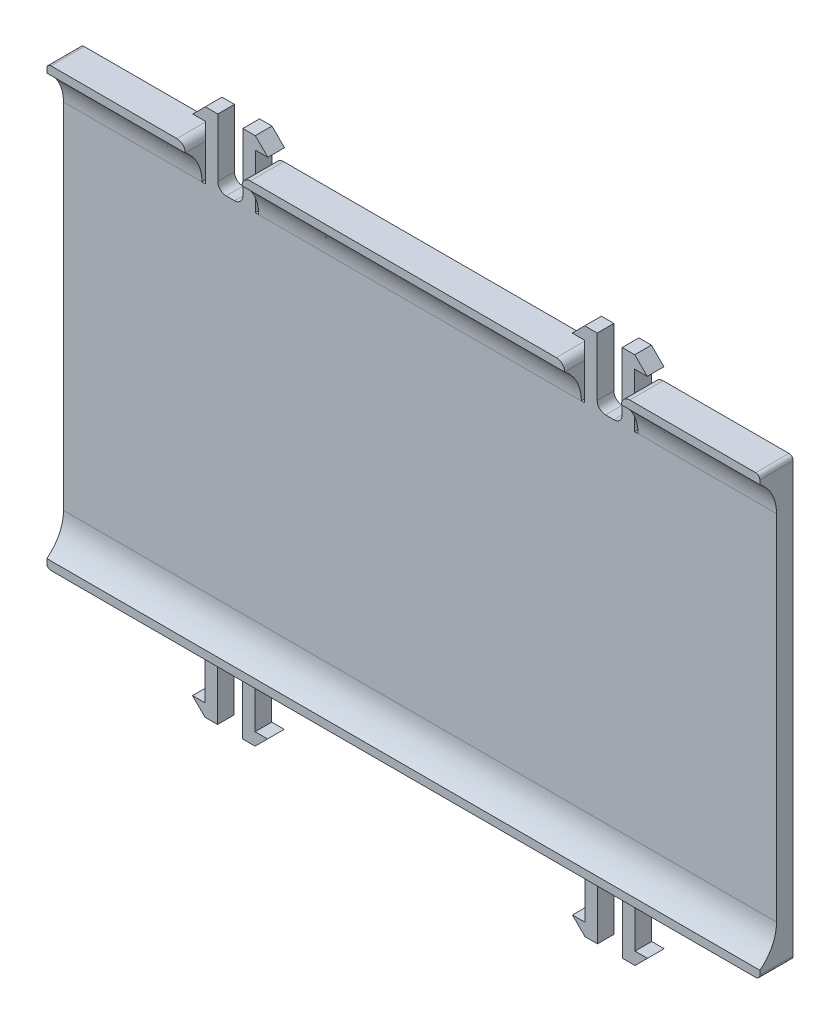
from build123d import *

# Parameters (mm, degrees)
SKETCH1_W            = 85.48
SKETCH1_H            = 52.4
BOSS_EXTRUDE1_DEPTH  = 2
BOSS_EXTRUDE2_DEPTH  = 2
SKETCH7_W            = 3
SKETCH7_H            = 5
SKETCH7_W_2          = 0.4
CUT_EXTRUDE2_DEPTH   = 55.775428798
FILLET4_R            = 1
FILLET4_OF_MIRROR2_R = 1
SKETCH8_W            = 85.48
SKETCH8_H            = 1
BOSS_EXTRUDE4_DEPTH  = 2
FILLET5_START        = -42.74
FILLET5_DEPTH        = 85.48
FILLET5_START_2      = -19.34
FILLET5_2_DEPTH      = 38.68
FILLET5_3_DEPTH      = 16.6
FILLET5_START_3      = 26.14
FILLET5_4_DEPTH      = 16.6
FILLET6_R            = 0.5


with BuildPart() as part:
    # Sketch1 → Boss-Extrude1 (new body)
    with BuildSketch(Plane.XY):
        Rectangle(SKETCH1_W, SKETCH1_H)
    extrude(amount=BOSS_EXTRUDE1_DEPTH)

    # Sketch2 → Boss-Extrude2 (add)
    with BuildSketch(Plane(origin=(0, 0, 0), x_dir=(-1, 0, 0), z_dir=(0, 0, -1))):
        Polygon((-27.24, 27.7), (-25.74, 27.7), (-25.74, 26.2), (-24.24, 26.2), (-24.24, 29.2), (-25.74, 29.2), align=None)
        Polygon((-19.74, 29.2), (-21.24, 29.2), (-21.24, 26.2), (-19.74, 26.2), (-19.74, 27.7), (-18.24, 27.7), align=None)
        Polygon((-25.773724333, -26.2), (-25.773724333, -32.7), (-27.273724333, -32.7), (-25.773724333, -34.2), (-24.273724333, -34.2), (-24.273724333, -26.2), align=None)
        Polygon((-21.273724333, -26.2), (-21.273724333, -34.2), (-19.773724333, -34.2), (-18.273724333, -32.7), (-19.773724333, -32.7), (-19.773724333, -26.2), align=None)
    boss_extrude2 = extrude(amount=-BOSS_EXTRUDE2_DEPTH)

    # Sketch7 → Cut-Extrude2 (cut, through all)
    with BuildSketch(Plane.XY.offset(2)):
        with Locations((22.74, 23.7)):
            Rectangle(SKETCH7_W, SKETCH7_H)
        with Locations((19.54, 23.7)):
            Rectangle(SKETCH7_W_2, SKETCH7_H)
        with Locations((25.94, 23.7)):
            Rectangle(SKETCH7_W_2, SKETCH7_H)
    cut_extrude2 = extrude(amount=-CUT_EXTRUDE2_DEPTH, mode=Mode.SUBTRACT)

    # Fillet4
    fillet4_edges = [part.edges().sort_by_distance(p)[0] for p in [
        (19.34, 26.2, 1),
        (21.24, 21.2, 1),
        (24.24, 21.2, 1),
        (24.273724333, -26.2, 1),
        (21.273724333, -26.2, 1),
        (26.14, 26.2, 1),
    ]]
    fillet(fillet4_edges, radius=FILLET4_R)

    # Mirror2: Boss-Extrude2, Cut-Extrude2 across plane
    add(boss_extrude2.mirror(Plane(origin=(0, 0, 0), x_dir=(0, 0, 1), z_dir=(1, 0, 0))))
    add(cut_extrude2.mirror(Plane(origin=(0, 0, 0), x_dir=(0, 0, 1), z_dir=(1, 0, 0))), mode=Mode.SUBTRACT)

    # Fillet4 of Mirror2
    fillet4_of_mirror2_edges = [part.edges().sort_by_distance(p)[0] for p in [
        (-19.34, 26.2, 1),
        (-21.24, 21.2, 1),
        (-24.24, 21.2, 1),
        (-24.273724333, -26.2, 1),
        (-21.273724333, -26.2, 1),
        (-26.14, 26.2, 1),
    ]]
    fillet(fillet4_of_mirror2_edges, radius=FILLET4_OF_MIRROR2_R)

    # Sketch8 → Boss-Extrude4 (add)
    with BuildSketch(Plane.XY.offset(2)):
        with BuildLine():
            Line((-42.74, 26.2), (-42.74, 25.2))
            Line((-42.74, 25.2), (-26.14, 25.2))
            ThreePointArc((-26.14, 25.2), (-26.432893219, 25.907106781), (-27.14, 26.2))
            Line((-27.14, 26.2), (-42.74, 26.2))
        make_face()
        with BuildLine():
            ThreePointArc((-18.34, 26.2), (-19.047106781, 25.907106781), (-19.34, 25.2))
            Line((-19.34, 25.2), (19.34, 25.2))
            ThreePointArc((19.34, 25.2), (19.047106781, 25.907106781), (18.34, 26.2))
            Line((18.34, 26.2), (-18.34, 26.2))
        make_face()
        with BuildLine():
            Line((26.14, 25.2), (42.74, 25.2))
            Line((42.74, 25.2), (42.74, 26.2))
            Line((42.74, 26.2), (27.14, 26.2))
            ThreePointArc((27.14, 26.2), (26.432893219, 25.907106781), (26.14, 25.2))
        make_face()
        with Locations((0, -25.7)):
            Rectangle(SKETCH8_W, SKETCH8_H)
    extrude(amount=BOSS_EXTRUDE4_DEPTH)

    # Fillet5: read off the stored shape, not the designer's step
    # Fillet5 outline → Fillet5 (add)
    with BuildSketch(Plane.YZ.offset(FILLET5_START)):
        with BuildLine():
            Line((-25.2, 2), (-21.2, 2))
            add(Edge.make_bspline(
                [(-21.2, 2), (-23.7, 2), (-25.2, 4)],
                knots=[0, 0, 0, 1, 1, 1], degree=2, weights=[1, 0.894427191, 1]))
            Line((-25.2, 4), (-25.2, 2))
        make_face()
    extrude(amount=FILLET5_DEPTH)

    # Fillet5 2 outline → Fillet5 2 (add)
    with BuildSketch(Plane.YZ.offset(FILLET5_START_2)):
        with BuildLine():
            add(Edge.make_bspline(
                [(25.2, 4), (23.7, 2), (21.2, 2)],
                knots=[0, 0, 0, 1, 1, 1], degree=2, weights=[1, 0.894427191, 1]))
            Line((21.2, 2), (25.2, 2))
            Line((25.2, 2), (25.2, 4))
        make_face()
    extrude(amount=FILLET5_2_DEPTH)

    # Fillet5 3 outline → Fillet5 3 (add)
    with BuildSketch(Plane.YZ.offset(FILLET5_START)):
        with BuildLine():
            add(Edge.make_bspline(
                [(25.2, 4), (23.7, 2), (21.2, 2)],
                knots=[0, 0, 0, 1, 1, 1], degree=2, weights=[1, 0.894427191, 1]))
            Line((21.2, 2), (25.2, 2))
            Line((25.2, 2), (25.2, 4))
        make_face()
    extrude(amount=FILLET5_3_DEPTH)

    # Fillet5 4 outline → Fillet5 4 (add)
    with BuildSketch(Plane.YZ.offset(FILLET5_START_3)):
        with BuildLine():
            add(Edge.make_bspline(
                [(25.2, 4), (23.7, 2), (21.2, 2)],
                knots=[0, 0, 0, 1, 1, 1], degree=2, weights=[1, 0.894427191, 1]))
            Line((21.2, 2), (25.2, 2))
            Line((25.2, 2), (25.2, 4))
        make_face()
    extrude(amount=FILLET5_4_DEPTH)

    # Fillet6
    fillet6_edges = [part.edges().sort_by_distance(p)[0] for p in [
        (-42.74, 26.2, 2),
        (42.74, 26.2, 2),
        (42.74, -26.2, 2),
        (-42.74, -26.2, 2),
    ]]
    fillet(fillet6_edges, radius=FILLET6_R)


solid = part.part
